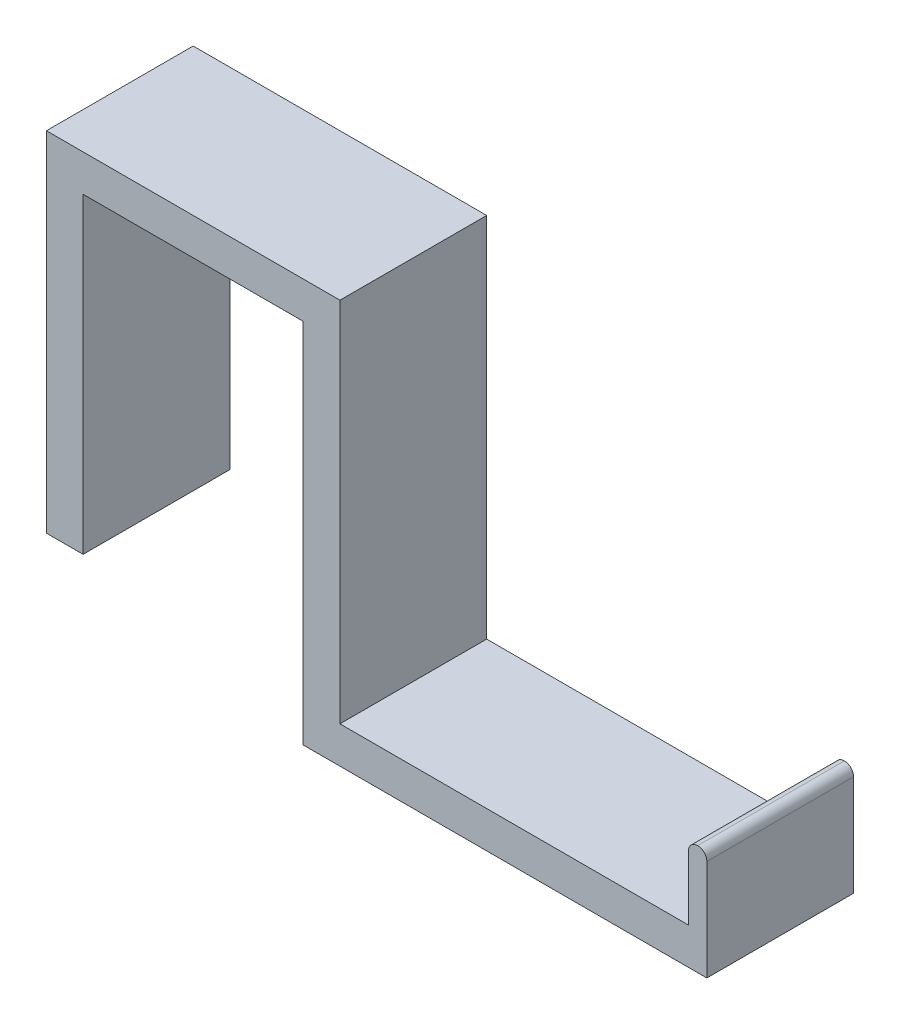
from build123d import *

# Parameters (mm, degrees)
SKETCH_1_W      = 10
SKETCH_1_H      = 90
SKETCH_1_W_2    = 80
SKETCH_1_H_2    = 10
SKETCH_1_W_3    = 5
SKETCH_1_H_3    = 20
SKETCH_1_H_4    = 85
EXTRUDE_1_DEPTH = 40
FILLET_1_R      = 2.5


with BuildPart() as part:
    # 草圖1 → 填料-伸長1 (new body)
    with BuildSketch(Plane.XY):
        with Locations((-34.732391425, -11.40625)):
            Rectangle(SKETCH_1_W, SKETCH_1_H)
        Polygon((-29.732391425, -56.40625), (-39.732391425, -56.40625), (-39.732391425, -66.40625), (70.267608575, -66.40625), (70.267608575, -56.40625), (65.267608575, -56.40625), align=None)
        with Locations((-69.732391425, 38.59375)):
            Rectangle(SKETCH_1_W_2, SKETCH_1_H_2)
        with Locations((67.767608575, -46.40625)):
            Rectangle(SKETCH_1_W_3, SKETCH_1_H_3)
        with Locations((-104.732391425, -8.90625)):
            Rectangle(SKETCH_1_W, SKETCH_1_H_4)
    extrude(amount=EXTRUDE_1_DEPTH)

    # 圓角1
    fillet_1_edges = [part.edges().sort_by_distance(p)[0] for p in [
        (70.267608575, -36.40625, 20),
        (65.267608575, -36.40625, 20),
    ]]
    fillet(fillet_1_edges, radius=FILLET_1_R - 0.0001)  # a hair under: the kernel refuses the full size


solid = part.part
